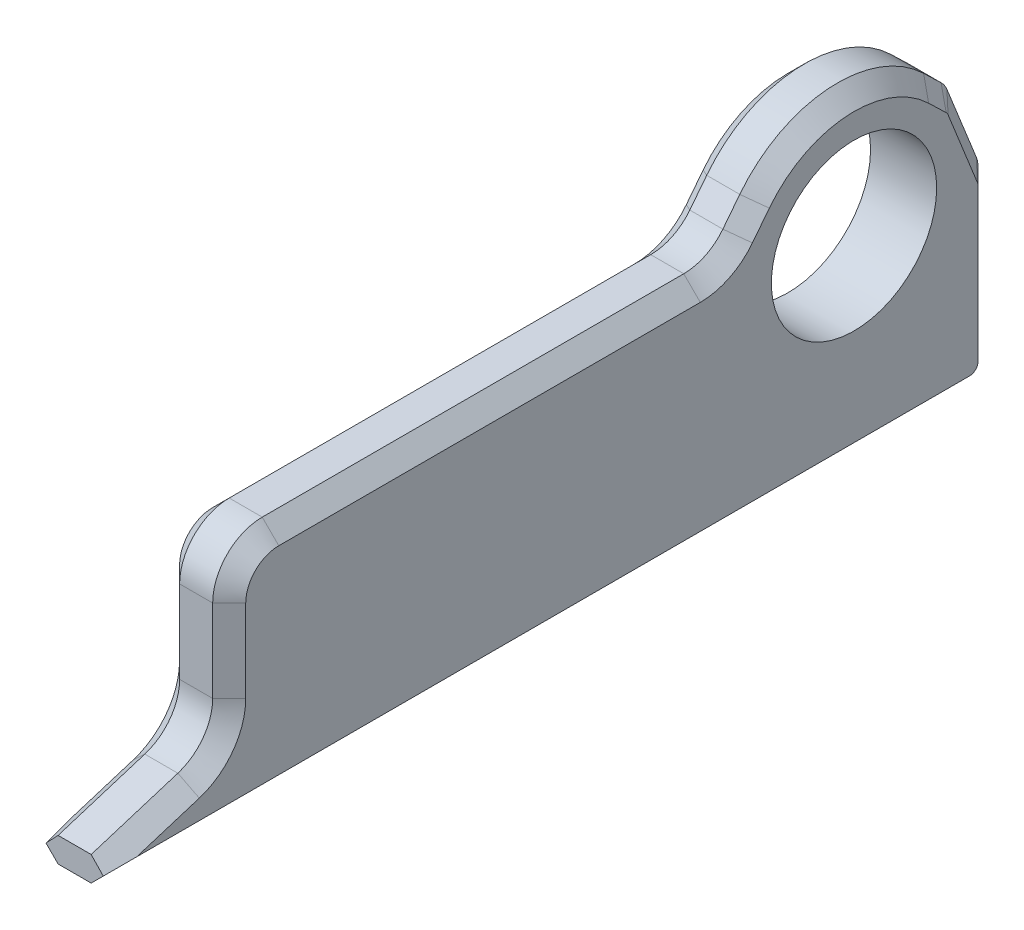
from build123d import *

# Parameters (mm, degrees)
SKETCH_1_R      = 50
EXTRUDE_1_DEPTH = 40
FILLET_1_R      = 15
FILLET_2_R      = 15
CHAMFER_1_SIZE  = 10


with BuildPart() as part:
    # 草图1 → 凸台-拉伸1 (new body)
    with BuildSketch(Plane(origin=(0, 0, 0), x_dir=(0, 0, -1), z_dir=(1, 0, 0))):
        with BuildLine():
            Line((85, -8.5), (65, 41.5))
            Line((65, 41.5), (52.08314884, 53.966152419))
            ThreePointArc((52.08314884, 53.966152419), (-5.26193851, 74.815185645), (-59.124192044, 46.14466291))
            Line((-59.124192044, 46.14466291), (-69.350323182, 33.042134836))
            ThreePointArc((-69.350323182, 33.042134836), (-79.842035775, 24.539510808), (-93, 21.5))
            Line((-93, 21.5), (-348, 21.5))
            ThreePointArc((-348, 21.5), (-369.213203436, 12.713203436), (-378, -8.5))
            Line((-378, -8.5), (-378, -58.5))
            ThreePointArc((-378, -58.5), (-383.833102889, -76.275294204), (-399.064072268, -87.138247076))
            Line((-399.064072268, -87.138247076), (-451.500924593, -103.5))
            Line((-451.500924593, -103.5), (-451.500924593, -118.5))
            Line((-451.500924593, -118.5), (-116.500924593, -118.5))
            Line((-116.500924593, -118.5), (85, -118.5))
            Line((85, -118.5), (85, -8.5))
        make_face()
        Circle(SKETCH_1_R, mode=Mode.SUBTRACT)
    extrude(amount=EXTRUDE_1_DEPTH)

    # 圆角1
    fillet_1_edges = [part.edges().sort_by_distance(p)[0] for p in [
        (20, -118.5, -85),
    ]]
    fillet(fillet_1_edges, radius=FILLET_1_R)

    # 圆角2
    fillet_2_edges = [part.edges().sort_by_distance(p)[0] for p in [
        (20, 41.5, -65),
        (20, -8.5, -85),
    ]]
    fillet(fillet_2_edges, radius=FILLET_2_R)

    # 倒角1
    # the kernel refuses this chamfer: 10 mm, written as the material it takes off along each edge
    with BuildSketch(Plane(origin=(40, -118.5, -70), x_dir=(0.027495876610586317, 0.9996219169112968, 0), z_dir=(0, 0, 1))) as chamfer_1_piece_1:
        Polygon((CHAMFER_1_SIZE * 0.999621916911, CHAMFER_1_SIZE * 0.0274958766106), (-CHAMFER_1_SIZE * 0.0274958766106, CHAMFER_1_SIZE * 0.999621916911), (0, 0), align=None)
    extrude(amount=547.217754472, mode=Mode.SUBTRACT)
    with BuildSketch(Plane(origin=(0, -118.5, 477.217754472), x_dir=(0.9996219169112968, -0.027495876610586317, 0), z_dir=(0, 0, -1))) as chamfer_1_piece_2:
        Polygon((CHAMFER_1_SIZE * 0.999621916911, -CHAMFER_1_SIZE * 0.0274958766106), (-CHAMFER_1_SIZE * 0.0274958766106, -CHAMFER_1_SIZE * 0.999621916911), (0, 0), align=None)
    extrude(amount=547.217754472, mode=Mode.SUBTRACT)
    with BuildSketch(Plane(origin=(40, -87.138247076, 399.064072268), x_dir=(0.02749587661058635, -0.9542473146313191, -0.2977516402781551), z_dir=(0, -0.297864257716727, 0.9546082358616352)), Plane(origin=(0, -87.138247076, 399.064072268), x_dir=(0.9996219169112968, 0.026247790264700862, 0.008190038876882964), z_dir=(0, -0.297864257716727, 0.9546082358616352))) as chamfer_1_piece_3:
        Polygon((CHAMFER_1_SIZE * 0.999621916911, -CHAMFER_1_SIZE * 0.0274958766106), (-CHAMFER_1_SIZE * 0.0274958766106, -CHAMFER_1_SIZE * 0.999621916911), (0, 0), align=None)
    extrude(amount=80.647062361, mode=Mode.SUBTRACT)
    with BuildSketch(Plane(origin=(40, -58.5, 408), x_dir=(0, 0, -1), z_dir=(0, 1, 0))) as chamfer_1_piece_4:
        Polygon((30 + CHAMFER_1_SIZE, 0), (30, CHAMFER_1_SIZE), (30, 0), align=None)
    revolve(axis=Axis((40, -58.5, 408), (-1, 0, 0)), revolution_arc=72.670629443, mode=Mode.SUBTRACT)
    with BuildSketch(Plane(origin=(40, -8.5, 378), x_dir=(0.027495876610586282, 0, -0.9996219169112968), z_dir=(0, -1, 0)), Plane(origin=(0, -8.5, 378), x_dir=(0.9996219169112968, 0, 0.0274958766105877), z_dir=(0, -1, 0))) as chamfer_1_piece_5:
        Polygon((CHAMFER_1_SIZE * 0.999621916911, -CHAMFER_1_SIZE * 0.0274958766106), (-CHAMFER_1_SIZE * 0.0274958766106, -CHAMFER_1_SIZE * 0.999621916911), (0, 0), align=None)
    extrude(amount=50, mode=Mode.SUBTRACT)
    with BuildSketch(Plane(origin=(40, -8.5, 348), x_dir=(0, 1, 0), z_dir=(0, 0, -1))) as chamfer_1_piece_6:
        Polygon((30 - CHAMFER_1_SIZE, 0), (30, -CHAMFER_1_SIZE), (30, 0), align=None)
    revolve(axis=Axis((40, -8.5, 348), (1, 0, 0)), revolution_arc=90, mode=Mode.SUBTRACT)
    with BuildSketch(Plane(origin=(40, 21.5, 93), x_dir=(0.027495876610586317, -0.9996219169112968, 0), z_dir=(0, 0, 1)), Plane(origin=(0, 21.5, 93), x_dir=(0.9996219169112968, 0.027495876610586317, 0), z_dir=(0, 0, 1))) as chamfer_1_piece_7:
        Polygon((CHAMFER_1_SIZE * 0.999621916911, -CHAMFER_1_SIZE * 0.0274958766106), (-CHAMFER_1_SIZE * 0.0274958766106, -CHAMFER_1_SIZE * 0.999621916911), (0, 0), align=None)
    extrude(amount=255, mode=Mode.SUBTRACT)
    with BuildSketch(Plane(origin=(40, 51.5, 93), x_dir=(0, -0.6152621721387623, -0.7883225605899479), z_dir=(0, 0.7883225605899479, -0.6152621721387623))) as chamfer_1_piece_8:
        Polygon((30 + CHAMFER_1_SIZE, 0), (30, CHAMFER_1_SIZE), (30, 0), align=None)
    revolve(axis=Axis((40, 51.5, 93), (-1, 0, 0)), revolution_arc=52.029027347, mode=Mode.SUBTRACT)
    with BuildSketch(Plane(origin=(40, 46.14466291, 59.124192044), x_dir=(0.027495876610586327, -0.6150295519163572, -0.788024509161346), z_dir=(0, -0.7883225605899483, 0.6152621721387617)), Plane(origin=(0, 46.14466291, 59.124192044), x_dir=(0.9996219169112968, 0.016917172768288757, 0.021675619855322733), z_dir=(0, -0.7883225605899483, 0.6152621721387617))) as chamfer_1_piece_9:
        Polygon((CHAMFER_1_SIZE * 0.999621916911, -CHAMFER_1_SIZE * 0.0274958766106), (-CHAMFER_1_SIZE * 0.0274958766106, -CHAMFER_1_SIZE * 0.999621916911), (0, 0), align=None)
    extrude(amount=16.620770139, mode=Mode.SUBTRACT)
    with BuildSketch(Plane(origin=(40, 0, 0), x_dir=(0, 0.7195486989139618, -0.6944419845395472), z_dir=(0, -0.6944419845395472, -0.7195486989139618))) as chamfer_1_piece_10:
        Polygon((75 - CHAMFER_1_SIZE, 0), (75, -CHAMFER_1_SIZE), (75, 0), align=None)
    revolve(axis=Axis((40, 0, 0), (1, 0, 0)), revolution_arc=96.011794601, mode=Mode.SUBTRACT)
    with BuildSketch(Plane(origin=(40, 43.734636446, -62.684572962), x_dir=(0.027495876610586317, -0.7192766497194039, 0.6941794277691075), z_dir=(0, 0.6944419845395474, 0.7195486989139617)), Plane(origin=(0, 43.734636446, -62.684572962), x_dir=(0.9996219169112968, 0.019784622240646275, -0.019094291120110143), z_dir=(0, 0.6944419845395474, 0.7195486989139617))) as chamfer_1_piece_11:
        Polygon((CHAMFER_1_SIZE * 0.999621916911, -CHAMFER_1_SIZE * 0.0274958766106), (-CHAMFER_1_SIZE * 0.0274958766106, -CHAMFER_1_SIZE * 0.999621916911), (0, 0), align=None)
    extrude(amount=14.733435189, mode=Mode.SUBTRACT)
    with BuildSketch(Plane(origin=(40, 32.941405963, -52.267943193), x_dir=(0, 0.3713906763541047, -0.9284766908852589), z_dir=(0, -0.9284766908852589, -0.3713906763541047))) as chamfer_1_piece_12:
        Polygon((15 - CHAMFER_1_SIZE, 0), (15, -CHAMFER_1_SIZE), (15, 0), align=None)
    revolve(axis=Axis((40, 32.941405963, -52.267943193), (1, 0, 0)), revolution_arc=24.215823259, mode=Mode.SUBTRACT)
    with BuildSketch(Plane(origin=(40, -5.817875908, -83.927150363), x_dir=(0.027495876610586313, -0.37125025982007287, 0.9281256495501801), z_dir=(0, 0.9284766908852591, 0.37139067635410444)), Plane(origin=(0, -5.817875908, -83.927150363), x_dir=(0.9996219169112968, 0.010211712211354702, -0.025529280528386704), z_dir=(0, 0.9284766908852591, 0.37139067635410444))) as chamfer_1_piece_13:
        Polygon((CHAMFER_1_SIZE * 0.999621916911, -CHAMFER_1_SIZE * 0.0274958766106), (-CHAMFER_1_SIZE * 0.0274958766106, -CHAMFER_1_SIZE * 0.999621916911), (0, 0), align=None)
    extrude(amount=47.745024136, mode=Mode.SUBTRACT)
    with BuildSketch(Plane(origin=(40, -11.388736054, -70), x_dir=(0, 0, -1), z_dir=(0, -1, 0))) as chamfer_1_piece_14:
        Polygon((15 - CHAMFER_1_SIZE, 0), (15, -CHAMFER_1_SIZE), (15, 0), align=None)
    revolve(axis=Axis((40, -11.388736054, -70), (1, 0, 0)), revolution_arc=21.801409486, mode=Mode.SUBTRACT)
    with BuildSketch(Plane(origin=(40, -103.5, -85), x_dir=(0.027495876610586282, 0, 0.9996219169112968), z_dir=(0, 1, 0)), Plane(origin=(0, -103.5, -85), x_dir=(0.9996219169112968, 0, -0.027495876610586317), z_dir=(0, 1, 0))) as chamfer_1_piece_15:
        Polygon((CHAMFER_1_SIZE * 0.999621916911, -CHAMFER_1_SIZE * 0.0274958766106), (-CHAMFER_1_SIZE * 0.0274958766106, -CHAMFER_1_SIZE * 0.999621916911), (0, 0), align=None)
    extrude(amount=92.111263946, mode=Mode.SUBTRACT)
    with BuildSketch(Plane(origin=(40, -103.5, -70), x_dir=(0, -1, 0), z_dir=(0, 0, 1))) as chamfer_1_piece_16:
        Polygon((15 - CHAMFER_1_SIZE, 0), (15, -CHAMFER_1_SIZE), (15, 0), align=None)
    revolve(axis=Axis((40, -103.5, -70), (1, 0, 0)), revolution_arc=90, mode=Mode.SUBTRACT)
    with BuildSketch(Plane(origin=(0, -58.5, 408), x_dir=(0, 0, -1), z_dir=(0, 1, 0))) as chamfer_1_piece_17:
        Polygon((30, -CHAMFER_1_SIZE), (30 + CHAMFER_1_SIZE, 0), (30, 0), align=None)
    revolve(axis=Axis((0, -58.5, 408), (-1, 0, 0)), revolution_arc=72.670629443, mode=Mode.SUBTRACT)
    with BuildSketch(Plane(origin=(0, -8.5, 348), x_dir=(0, 1, 0), z_dir=(0, 0, -1))) as chamfer_1_piece_18:
        Polygon((30, CHAMFER_1_SIZE), (30 - CHAMFER_1_SIZE, 0), (30, 0), align=None)
    revolve(axis=Axis((0, -8.5, 348), (1, 0, 0)), revolution_arc=90, mode=Mode.SUBTRACT)
    with BuildSketch(Plane(origin=(0, 51.5, 93), x_dir=(0, -0.6152621721387623, -0.7883225605899479), z_dir=(0, 0.7883225605899479, -0.6152621721387623))) as chamfer_1_piece_19:
        Polygon((30, -CHAMFER_1_SIZE), (30 + CHAMFER_1_SIZE, 0), (30, 0), align=None)
    revolve(axis=Axis((0, 51.5, 93), (-1, 0, 0)), revolution_arc=52.029027347, mode=Mode.SUBTRACT)
    with BuildSketch(Plane(origin=(0, 0, 0), x_dir=(0, 0.7195486989139618, -0.6944419845395472), z_dir=(0, -0.6944419845395472, -0.7195486989139618))) as chamfer_1_piece_20:
        Polygon((75, CHAMFER_1_SIZE), (75 - CHAMFER_1_SIZE, 0), (75, 0), align=None)
    revolve(axis=Axis((0, 0, 0), (1, 0, 0)), revolution_arc=96.011794601, mode=Mode.SUBTRACT)
    with BuildSketch(Plane(origin=(0, 32.941405963, -52.267943193), x_dir=(0, 0.3713906763541047, -0.9284766908852589), z_dir=(0, -0.9284766908852589, -0.3713906763541047))) as chamfer_1_piece_21:
        Polygon((15, CHAMFER_1_SIZE), (15 - CHAMFER_1_SIZE, 0), (15, 0), align=None)
    revolve(axis=Axis((0, 32.941405963, -52.267943193), (1, 0, 0)), revolution_arc=24.215823259, mode=Mode.SUBTRACT)
    with BuildSketch(Plane(origin=(0, -11.388736054, -70), x_dir=(0, 0, -1), z_dir=(0, -1, 0))) as chamfer_1_piece_22:
        Polygon((15, CHAMFER_1_SIZE), (15 - CHAMFER_1_SIZE, 0), (15, 0), align=None)
    revolve(axis=Axis((0, -11.388736054, -70), (1, 0, 0)), revolution_arc=21.801409486, mode=Mode.SUBTRACT)
    with BuildSketch(Plane(origin=(0, -103.5, -70), x_dir=(0, -1, 0), z_dir=(0, 0, 1))) as chamfer_1_piece_23:
        Polygon((15, CHAMFER_1_SIZE), (15 - CHAMFER_1_SIZE, 0), (15, 0), align=None)
    revolve(axis=Axis((0, -103.5, -70), (1, 0, 0)), revolution_arc=90, mode=Mode.SUBTRACT)


solid = part.part
